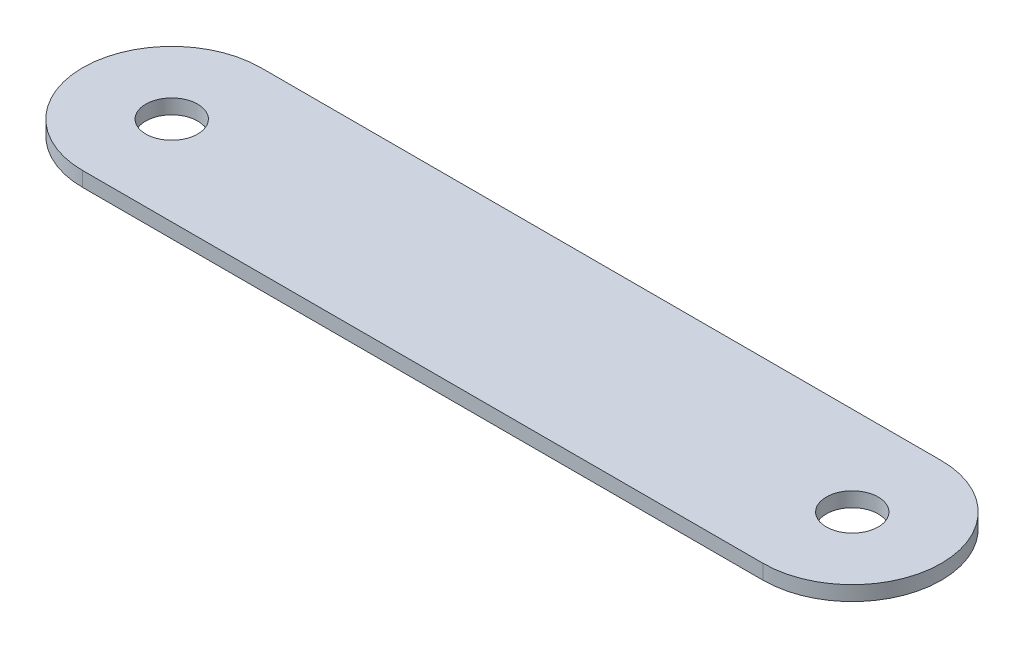
from build123d import *

# Parameters (mm, degrees)
SKETCH1_R           = 5.3
BOSS_EXTRUDE1_DEPTH = 3


with BuildPart() as part:
    # Sketch1 → Boss-Extrude1 (new body)
    with BuildSketch(Plane(origin=(0, 0, 0), x_dir=(1, 0, 0), z_dir=(0, 1, 0))):
        with BuildLine():
            Line((-69.5, 18.193025217), (69.5, 18.193025217))
            ThreePointArc((69.5, 18.193025217), (87.693025217, 0), (69.5, -18.193025217))
            Line((69.5, -18.193025217), (-69.5, -18.193025217))
            ThreePointArc((-69.5, -18.193025217), (-87.693025217, 0), (-69.5, 18.193025217))
        make_face()
        with Locations((-69.5, 0)):
            Circle(SKETCH1_R, mode=Mode.SUBTRACT)
        with Locations((69.5, 0)):
            Circle(SKETCH1_R, mode=Mode.SUBTRACT)
    extrude(amount=BOSS_EXTRUDE1_DEPTH)


solid = part.part
